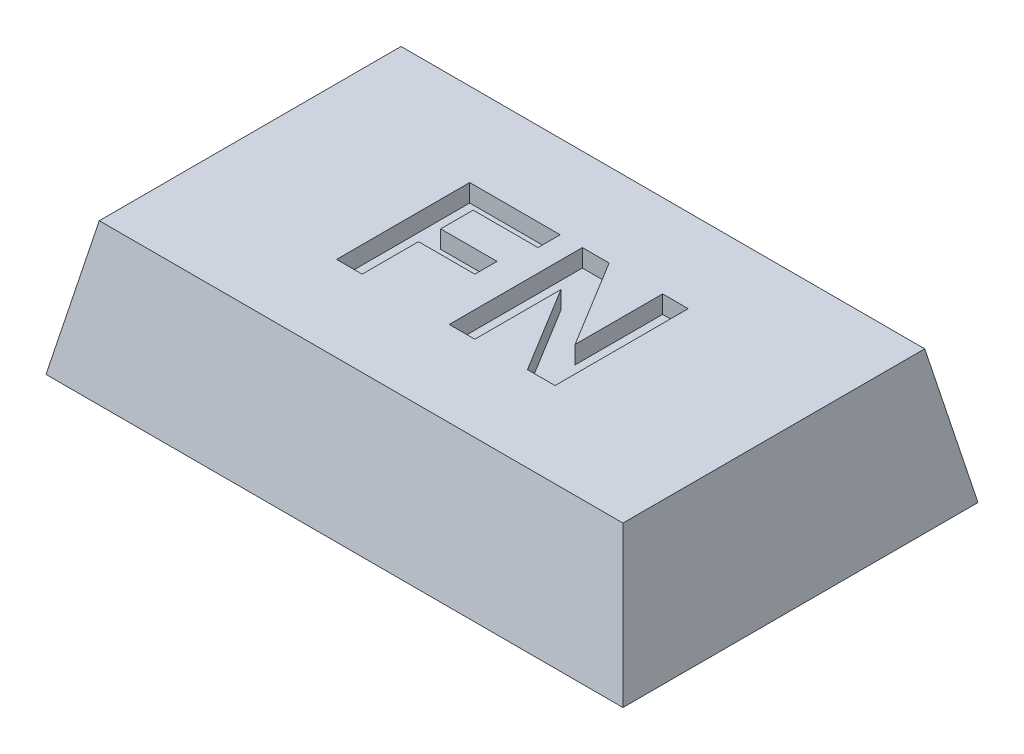
from build123d import *

# Parameters (mm, degrees)
SKETCH1_W               = 13
SKETCH1_H               = 8
BOSS_EXTRUDE1_DEPTH     = 3
CUT_EXTRUDE1_DEPTH      = 16.556349186
CUT_EXTRUDE1_DEPTH_BACK = 16.556349186
CUT_EXTRUDE2_DEPTH      = 16.556349186
CUT_EXTRUDE2_DEPTH_BACK = 16.556349186
SKETCH4_R               = 1.75
CUT_EXTRUDE3_DEPTH      = 0.4
SKETCH5_W               = 8
SKETCH5_H               = 1.1
BOSS_EXTRUDE2_DEPTH     = 2
FILLET1_R               = 4
CUT_EXTRUDE4_DEPTH      = 0.4


with BuildPart() as part:
    # Sketch1 → Boss-Extrude1 (new body)
    with BuildSketch(Plane(origin=(0, 0, 0), x_dir=(1, 0, 0), z_dir=(0, 1, 0))):
        with Locations((6.5, 4)):
            Rectangle(SKETCH1_W, SKETCH1_H)
    extrude(amount=BOSS_EXTRUDE1_DEPTH)

    # Sketch2 → Cut-Extrude1 (cut, two sides: drawn at the far end of the back side and taken through both)
    with BuildSketch(Plane.XY.offset(-CUT_EXTRUDE1_DEPTH_BACK)):
        Polygon((0, 0), (0.6, 3), (0, 3), align=None)
        Polygon((13, 0), (12.4, 3), (13, 3), align=None)
    extrude(amount=CUT_EXTRUDE1_DEPTH + CUT_EXTRUDE1_DEPTH_BACK, mode=Mode.SUBTRACT)

    # Sketch3 → Cut-Extrude2 (cut, two sides: drawn at the far end of the back side and taken through both)
    with BuildSketch(Plane(origin=(0, 0, 0), x_dir=(0, 0, -1), z_dir=(1, 0, 0)).offset(-CUT_EXTRUDE2_DEPTH_BACK)):
        Polygon((0, 0), (0.6, 3), (0, 3), align=None)
        Polygon((8, 3), (7.4, 3), (8, 0), align=None)
    extrude(amount=CUT_EXTRUDE2_DEPTH + CUT_EXTRUDE2_DEPTH_BACK, mode=Mode.SUBTRACT)

    # Sketch4 → Cut-Extrude3 (cut)
    with BuildSketch(Plane.XZ):
        with Locations(Location((6.50000125, -3.75, 0), (0, 0, 270))):
            Circle(SKETCH4_R)
    extrude(amount=-CUT_EXTRUDE3_DEPTH, mode=Mode.SUBTRACT)

    # Sketch5 → Boss-Extrude2 (add)
    with BuildSketch(Plane.XZ):
        with Locations((6.500011, -7.45)):
            Rectangle(SKETCH5_W, SKETCH5_H)
    extrude(amount=BOSS_EXTRUDE2_DEPTH)

    # Fillet1
    # the kernel refuses this fillet: 4 mm, written as the material it takes off along each edge
    with BuildSketch(Plane(origin=(10.500011, -2, -16.660254038), x_dir=(0, 1, 0), z_dir=(0, 0, 1)), Plane(origin=(2.500011, -2, 1.760254038), x_dir=(0, 1, 0), z_dir=(0, 0, -1))) as fillet1_piece_1:
        with BuildLine():
            CenterArc((4, 3.464101615), FILLET1_R, 180, 60)
            Line((0, 3.464101615), (-0.08, 3.464101615))
            Line((-0.08, 3.464101615), (-0.08, 0))
            Line((-0.08, 0), (0, -0.08))
            ThreePointArc((0, -0.08), (1, -0.08), (1.96, -0.069282032))
            Line((1.96, -0.069282032), (2, 0))
        make_face()
    extrude(amount=18.420508076, mode=Mode.SUBTRACT)

    # Sketch6 → Cut-Extrude4 (cut)
    with BuildSketch(Plane(origin=(0, 3, 0), x_dir=(1, 0, 0), z_dir=(0, 1, 0))):
        Polygon((4.028737707, 2.518536397), (4.028737707, 5.518536397), (6.067199245, 5.518536397), (6.067199245, 5.018536397), (4.605660784, 5.018536397), (4.605660784, 4.287767167), (5.874891553, 4.287767167), (5.874891553, 3.787767167), (4.605660784, 3.787767167), (4.605660784, 2.518536397), align=None)
        Polygon((6.567199245, 2.518536397), (6.567199245, 5.518536397), (7.169963668, 5.518536397), (8.374891553, 3.546180628), (8.374891553, 5.518536397), (8.95181463, 5.518536397), (8.95181463, 2.518536397), (8.330420399, 2.518536397), (7.144122322, 4.459642167), (7.144122322, 2.518536397), align=None)
    extrude(amount=-CUT_EXTRUDE4_DEPTH, mode=Mode.SUBTRACT)


solid = part.part
